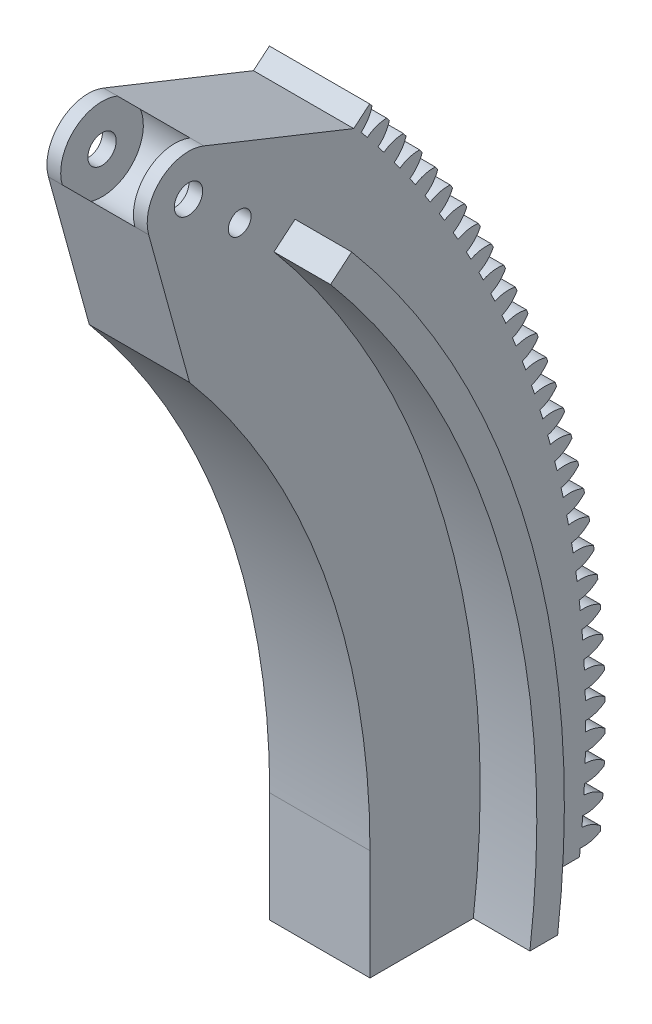
from build123d import *

# Parameters (mm, degrees)
TEETH_BLANK_DEPTH                              = 6.35
PRIMARY_BLANK_DEPTH                            = 29.464
TOOTH_CUT_DEPTH                                = 6.35
TOOTH_PATTERN_COUNT                            = 230
HOLES_FOR_TOP_SUPPORT_DEPTH                    = 284.05774535
HOLES_FOR_TOP_SUPPORT_DEPTH_BACK               = 284.05774535
SKETCH15_R                                     = 3.2639
THING_TO_SLIDE_ALONG_BEARINGS_DEPTH            = 9.87425
EXTENDING_START                                = 23.01875
EXTENDING_TEETH_DEPTH                          = 23.01875
SKETCH28_R                                     = 9.525
CUT_FOR_SPACE_FOR_TOP_SUPPORT_SCREWS_DEPTH     = 16.764
SKETCH29_R                                     = 3.429
MAGNET_HOLE_DEPTH                              = 12.7
CUT_START                                      = -3.175
CUT_TO_MAKE_SPACE_FOR_ALUMINUM_REINFORCE_DEPTH = 3.175
SKETCH31_R                                     = 2.6289
CUT_EXTRUDE1_DEPTH                             = 285.420834078


with BuildPart() as part:
    # Sketch11 → Teeth blank (new body)
    with BuildSketch(Plane(origin=(6.35, 0, 0), x_dir=(0, 0, -1), z_dir=(1, 0, 0))):
        with BuildLine():
            Line((177.722316491, 149.126730219), (155.660230842, 130.614442288))
            ThreePointArc((155.660230842, 130.614442288), (190.945540544, 69.498493124), (203.2, 0))
            ThreePointArc((203.2, 0), (202.801171077, -12.724975829), (201.606249903, -25.4))
            Line((201.606249903, -25.4), (230.605384683, -25.4))
            ThreePointArc((230.605384683, -25.4), (231.65108936, -12.719129025), (232.000007424, 0))
            ThreePointArc((232.000007424, 0), (218.008694999, 79.348675791), (177.722316491, 149.126730219))
        make_face()
    extrude(amount=-TEETH_BLANK_DEPTH)

    # Sketch1 → Primary blank (add)
    with BuildSketch(Plane(origin=(0, 0, 0), x_dir=(0, 0, -1), z_dir=(1, 0, 0))):
        with BuildLine():
            Line((177.8, 0), (177.8, -25.4))
            Line((177.8, -25.4), (225.775729431, -25.4))
            ThreePointArc((225.775729431, -25.4), (226.843652905, -12.71995034), (227.2, 0))
            ThreePointArc((227.2, 0), (213.498163443, 77.706976564), (174.045297477, 146.041344921))
            Line((174.045297477, 146.041344921), (139.503343029, 159.851365822))
            ThreePointArc((139.503343029, 159.851365822), (129.618020291, 158.107153482), (126.784391338, 148.47738561))
            Line((126.784391338, 148.47738561), (136.202701987, 114.287637002))
            ThreePointArc((136.202701987, 114.287637002), (167.077347976, 60.811181483), (177.8, 0))
        make_face()
    extrude(amount=PRIMARY_BLANK_DEPTH)

    # Sketch12 → Tooth cut (cut)
    with BuildSketch(Plane(origin=(6.35, 0, 0), x_dir=(0, 0, -1), z_dir=(1, 0, 0))):
        with BuildLine():
            ThreePointArc((227.497230324, 1.124058456), (230.494867292, 1.773780404), (232.972473, 3.581938572))
            ThreePointArc((232.972473, 3.581938572), (233.000007424, 0), (232.972473, -3.581938572))
            ThreePointArc((232.972473, -3.581938572), (230.494867292, -1.773780404), (227.497230324, -1.124058456))
            ThreePointArc((227.497230324, -1.124058456), (227.50000728, 0), (227.497230324, 1.124058456))
        make_face()
    tooth_cut = extrude(amount=-TOOTH_CUT_DEPTH, mode=Mode.SUBTRACT)

    # Tooth pattern: Tooth cut ×230 about axis
    tooth_pattern_axis = Axis((0, 0, 0), (1, 0, 0))
    for i in range(1, TOOTH_PATTERN_COUNT):
        add(tooth_cut.rotate(tooth_pattern_axis, i * 360 / TOOTH_PATTERN_COUNT), mode=Mode.SUBTRACT)

    # Sketch15 → Holes for top support (cut, two sides: drawn at the far end of the back side and taken through both)
    with BuildSketch(Plane(origin=(6.35, 0, 0), x_dir=(0, 0, -1), z_dir=(1, 0, 0)).offset(-HOLES_FOR_TOP_SUPPORT_DEPTH_BACK)):
        with Locations((135.967339212, 151.007028537)):
            Circle(SKETCH15_R)
    extrude(amount=HOLES_FOR_TOP_SUPPORT_DEPTH + HOLES_FOR_TOP_SUPPORT_DEPTH_BACK, mode=Mode.SUBTRACT)

    # Sketch23 → Thing to slide along bearings (add)
    with BuildSketch(Plane(origin=(0, 0, 0), x_dir=(0, 0, -1), z_dir=(1, 0, 0))):
        with BuildLine():
            Line((155.660230842, 130.614442288), (160.524613056, 134.69614361))
            ThreePointArc((160.524613056, 134.69614361), (196.912588686, 71.670321034), (209.55, 0))
            ThreePointArc((209.55, 0), (209.163370775, -12.723475387), (208.004909798, -25.4))
            Line((208.004909798, -25.4), (201.606249903, -25.4))
            ThreePointArc((201.606249903, -25.4), (202.801171077, -12.724975829), (203.2, 0))
            ThreePointArc((203.2, 0), (190.945540544, 69.498493124), (155.660230842, 130.614442288))
        make_face()
    thing_to_slide_along_bearings = extrude(amount=-THING_TO_SLIDE_ALONG_BEARINGS_DEPTH)

    # Mirroring slider: Thing to slide along bearings across plane
    add(thing_to_slide_along_bearings.mirror(Plane(origin=(14.732, 0, 0), x_dir=(0, 0, 1), z_dir=(1, 0, 0))))

    # Sketch27 → Extending teeth (add)
    with BuildSketch(Plane(origin=(6.35, 0, 0), x_dir=(0, 0, -1), z_dir=(1, 0, 0)).offset(EXTENDING_START)):
        with BuildLine():
            Line((177.722316491, 149.126730219), (174.045297477, 146.041344921))
            ThreePointArc((174.045297477, 146.041344921), (217.513785946, 65.632255207), (225.775729431, -25.4))
            Line((225.775729431, -25.4), (226.07762674, -25.4))
            ThreePointArc((226.07762674, -25.4), (226.171897735, -24.546404775), (226.262945845, -23.692459772))
            ThreePointArc((226.262945845, -23.692459772), (228.663101283, -23.551544215), (230.891757831, -22.649494707))
            ThreePointArc((230.891757831, -22.649494707), (230.94034564, -22.148593645), (230.987846786, -21.647588364))
            ThreePointArc((230.987846786, -21.647588364), (228.971262049, -20.338394215), (226.641640358, -19.743864063))
            ThreePointArc((226.641640358, -19.743864063), (226.736426656, -18.623805724), (226.825677683, -17.503292725))
            ThreePointArc((226.825677683, -17.503292725), (229.221088498, -17.296869983), (231.424274191, -16.33428174))
            ThreePointArc((231.424274191, -16.33428174), (231.459161859, -15.832240407), (231.492960423, -15.330124577))
            ThreePointArc((231.492960423, -15.330124577), (229.441367736, -14.07650152), (227.096375799, -13.545826347))
            ThreePointArc((227.096375799, -13.545826347), (227.160532561, -12.423596854), (227.219143699, -11.301064066))
            ThreePointArc((227.219143699, -11.301064066), (229.608022346, -11.029288179), (231.784093084, -10.006879521))
            ThreePointArc((231.784093084, -10.006879521), (231.805254577, -9.504072559), (231.825325337, -9.001220877))
            ThreePointArc((231.825325337, -9.001220877), (229.740255675, -7.804104412), (227.381643413, -7.337680228))
            ThreePointArc((227.381643413, -7.337680228), (227.415122764, -6.21411703), (227.443050275, -5.090402129))
            ThreePointArc((227.443050275, -5.090402129), (229.823614083, -4.753475906), (231.970946001, -3.672009792))
            ThreePointArc((231.970946001, -3.672009792), (231.978365527, -3.168812415), (231.984693505, -2.665600128))
            ThreePointArc((231.984693505, -2.665600128), (229.867702826, -1.525883589), (227.497230324, -1.124058456))
            ThreePointArc((227.497230324, -1.124058456), (227.50000728, 0), (227.497230324, 1.124058456))
            ThreePointArc((227.497230324, 1.124058456), (229.867702826, 1.525883589), (231.984693505, 2.665600128))
            ThreePointArc((231.984693505, 2.665600128), (231.978365527, 3.168812415), (231.970946001, 3.672009792))
            ThreePointArc((231.970946001, 3.672009792), (229.823614083, 4.753475906), (227.443050275, 5.090402129))
            ThreePointArc((227.443050275, 5.090402129), (227.415122764, 6.21411703), (227.381643413, 7.337680228))
            ThreePointArc((227.381643413, 7.337680228), (229.740255675, 7.804104412), (231.825325337, 9.001220877))
            ThreePointArc((231.825325337, 9.001220877), (231.805254577, 9.504072559), (231.784093084, 10.006879521))
            ThreePointArc((231.784093084, 10.006879521), (229.608022346, 11.029288179), (227.219143699, 11.301064066))
            ThreePointArc((227.219143699, 11.301064066), (227.160532561, 12.423596854), (227.096375799, 13.545826347))
            ThreePointArc((227.096375799, 13.545826347), (229.441367736, 14.07650152), (231.492960423, 15.330124577))
            ThreePointArc((231.492960423, 15.330124577), (231.459161859, 15.832240407), (231.424274191, 16.33428174))
            ThreePointArc((231.424274191, 16.33428174), (229.221088498, 17.296869983), (226.825677683, 17.503292725))
            ThreePointArc((226.825677683, 17.503292725), (226.736426656, 18.623805724), (226.641640358, 19.743864063))
            ThreePointArc((226.641640358, 19.743864063), (228.971262049, 20.338394215), (230.987846786, 21.647588364))
            ThreePointArc((230.987846786, 21.647588364), (230.94034564, 22.148593645), (230.891757831, 22.649494707))
            ThreePointArc((230.891757831, 22.649494707), (228.663101283, 23.551544215), (226.262945845, 23.692459772))
            ThreePointArc((226.262945845, 23.692459772), (226.143121532, 24.810116812), (226.017776432, 25.927168167))
            ThreePointArc((226.017776432, 25.927168167), (228.330289425, 26.585109638), (230.310361361, 27.94889791))
            ThreePointArc((230.310361361, 27.94889791), (230.24919308, 28.448418771), (230.186941388, 28.947805772))
            ThreePointArc((230.186941388, 28.947805772), (227.934477093, 29.788643403), (225.531368117, 29.863946617))
            ThreePointArc((225.531368117, 29.863946617), (225.381059935, 30.977913661), (225.225249571, 32.091124447))
            ThreePointArc((225.225249571, 32.091124447), (227.518928183, 32.811986256), (229.461009714, 34.22935094))
            ThreePointArc((229.461009714, 34.22935094), (229.386219944, 34.727014622), (229.310350824, 35.2245149))
            ThreePointArc((229.310350824, 35.2245149), (227.035759654, 36.003513188), (224.631490431, 36.013147865))
            ThreePointArc((224.631490431, 36.013147865), (224.450810546, 37.12259363), (224.264651187, 38.231133128))
            ThreePointArc((224.264651187, 38.231133128), (226.537783789, 39.01437734), (228.440425662, 40.484260746))
            ThreePointArc((228.440425662, 40.484260746), (228.352070214, 40.979695873), (228.262640281, 41.474938174))
            ThreePointArc((228.262640281, 41.474938174), (225.967619622, 42.191515802), (223.563984308, 42.135474753))
            ThreePointArc((223.563984308, 42.135474753), (223.353067549, 43.239571328), (223.136698117, 44.342612304))
            ThreePointArc((223.136698117, 44.342612304), (225.387588412, 45.187654434), (227.249370803, 46.70895968))
            ThreePointArc((227.249370803, 46.70895968), (227.147515611, 47.201796539), (227.044591603, 47.694411295))
            ThreePointArc((227.044591603, 47.694411295), (224.730854085, 48.348033526), (222.329646362, 48.226358571))
            ThreePointArc((222.329646362, 48.226358571), (222.088650124, 49.324282038), (221.84223208, 50.421001361))
            ThreePointArc((221.84223208, 50.421001361), (224.06920037, 51.327210806), (225.888733947, 52.898802637))
            ThreePointArc((225.888733947, 52.898802637), (225.773455019, 53.388673455), (225.657113741, 53.878293059))
            ThreePointArc((225.657113741, 53.878293059), (223.326385962, 54.468472135), (220.929397701, 54.281254073))
            ThreePointArc((220.929397701, 54.281254073), (220.658501825, 55.37218512), (220.382219056, 56.461764377))
            ThreePointArc((220.382219056, 56.461764377), (222.583603493, 57.428464891), (224.359530453, 59.049170525))
            ThreePointArc((224.359530453, 59.049170525), (224.230913815, 59.535709743), (224.101242084, 60.021968822))
            ThreePointArc((224.101242084, 60.021968822), (221.75526332, 60.54826433), (219.364283245, 60.295642869))
            ThreePointArc((219.364283245, 60.295642869), (219.063689882, 61.378767402), (218.75774856, 62.460393508))
            ThreePointArc((218.75774856, 62.460393508), (220.931906389, 63.486863702), (222.662901469, 65.15547371))
            ThreePointArc((222.662901469, 65.15547371), (222.521043099, 65.638318252), (222.378137682, 66.120853942))
            ThreePointArc((222.378137682, 66.120853942), (220.01865859, 66.58287314), (217.635470939, 66.265036796))
            ThreePointArc((217.635470939, 66.265036796), (217.305404404, 67.339546548), (216.970032835, 68.412412353))
            ThreePointArc((216.970032835, 68.412412353), (219.115341617, 69.497886237), (220.800113083, 71.213155438))
            ThreePointArc((220.800113083, 71.213155438), (220.645118841, 71.691944989), (220.489086379, 72.170397203))
            ThreePointArc((220.489086379, 72.170397203), (218.117867692, 72.567795315), (215.744250889, 72.18498127))
            ThreePointArc((215.744250889, 72.18498127), (215.384957489, 73.250074401), (215.02040594, 74.313379293))
            ThreePointArc((215.02040594, 74.313379293), (217.135264766, 75.457046844), (218.772555378, 77.21769524))
            ThreePointArc((218.772555378, 77.21769524), (218.604540927, 77.69207251), (218.435497858, 78.166084208))
            ThreePointArc((218.435497858, 78.166084208), (216.054309067, 78.498564682), (213.692034393, 78.051058605))
            ThreePointArc((213.692034393, 78.051058605), (213.303782248, 79.105940303), (212.91032276, 80.158890803))
            ThreePointArc((212.91032276, 80.158890803), (214.993153443, 81.359898575), (216.581741393, 83.164612305))
            ThreePointArc((216.581741393, 83.164612305), (216.400832112, 83.634223294), (216.218904581, 84.103440753))
            ThreePointArc((216.218904581, 84.103440753), (213.829522619, 84.370755478), (211.480352893, 83.858891315))
            ThreePointArc((211.480352893, 83.858891315), (211.06343173, 84.902774388), (210.641357917, 85.944584746))
            ThreePointArc((210.641357917, 85.944584746), (212.690606171, 87.202036501), (214.229305997, 89.049468819))
            ThreePointArc((214.229305997, 89.049468819), (214.035636886, 89.513963087), (213.840960655, 89.978036158))
            ThreePointArc((213.840960655, 89.978036158), (211.445168568, 90.179985654), (209.110856828, 89.604145378))
            ThreePointArc((209.110856828, 89.604145378), (208.66557777, 90.63625084), (208.2152046, 91.666143618))
            ThreePointArc((208.2152046, 91.666143618), (210.229341199, 92.979100999), (211.717004663, 94.867873282))
            ThreePointArc((211.717004663, 94.867873282), (211.510720247, 95.326904206), (211.30344059, 95.78548658))
            ThreePointArc((211.30344059, 95.78548658), (208.903026208, 95.921920145), (206.585314405, 95.28253347))
            ThreePointArc((206.585314405, 95.28253347), (206.112009735, 96.302091126), (205.633673294, 97.319297778))
            ThreePointArc((205.633673294, 97.319297778), (207.611195213, 98.686781007), (209.046712167, 100.615483783))
            ThreePointArc((209.046712167, 100.615483783), (208.827966381, 101.068708817), (208.608237979, 101.521458283))
            ThreePointArc((208.608237979, 101.521458283), (206.204992582, 101.592274105), (203.905610279, 100.889818164))
            ThreePointArc((203.905610279, 100.889818164), (203.404633195, 101.896067182), (202.898690434, 102.899828632))
            ThreePointArc((202.898690434, 102.899828632), (204.838121973, 104.320817242), (206.220421179, 106.28801124))
            ThreePointArc((206.220421179, 106.28801124), (205.989377261, 106.735092169), (205.757364083, 107.181670869))
            ThreePointArc((205.757364083, 107.181670869), (203.353081061, 107.186816103), (201.073744144, 106.421815095))
            ThreePointArc((201.073744144, 106.421815095), (200.545468495, 107.414004574), (200.012296968, 108.403571777))
            ThreePointArc((200.012296968, 108.403571777), (201.91219085, 109.877005372), (203.240240785, 111.881222599))
            ThreePointArc((203.240240785, 111.881222599), (202.997071148, 112.321825796), (202.752946331, 112.761900475))
            ThreePointArc((202.752946331, 112.761900475), (200.349419851, 112.701371281), (198.091829247, 111.874396079))
            ThreePointArc((198.091829247, 111.874396079), (197.53664925, 112.851785611), (196.97664683, 113.826420114))
            ThreePointArc((196.97664683, 113.826420114), (198.835585283, 115.351199164), (200.108394907, 117.390943997))
            ThreePointArc((200.108394907, 117.390943997), (199.853281013, 117.824740666), (199.597226732, 118.257982925))
            ThreePointArc((199.597226732, 118.257982925), (197.196250396, 118.131824473), (194.962090802, 117.243492197))
            ThreePointArc((194.962090802, 117.243492197), (194.380420754, 118.205352416), (193.794005336, 119.164326911))
            ThreePointArc((193.794005336, 119.164326911), (195.610601151, 120.739313568), (196.827220645, 122.813063873))
            ThreePointArc((196.827220645, 122.813063873), (196.56035287, 123.2397303), (196.292560202, 123.665816837))
            ThreePointArc((196.292560202, 123.665816837), (193.895925708, 123.47412327), (191.686864339, 122.525096826))
            ThreePointArc((191.686864339, 122.525096826), (191.079138305, 123.470709957), (190.466747493, 124.413308821))
            ThreePointArc((190.466747493, 124.413308821), (192.239645057, 126.037327771), (193.399166535, 128.143536038))
            ThreePointArc((193.399166535, 128.143536038), (193.120744025, 128.562753829), (192.841412808, 128.981366682))
            ThreePointArc((192.841412808, 128.981366682), (190.450908614, 128.724281049), (188.268593954, 127.715268637))
            ThreePointArc((188.268593954, 127.715268637), (187.635265441, 128.643929027), (186.997356225, 129.569448858))
            ThreePointArc((186.997356225, 129.569448858), (188.725232536, 131.241288196), (189.826790719, 133.378382695))
            ThreePointArc((189.826790719, 133.378382695), (189.537021244, 133.789839012), (189.246359924, 134.200665797))
            ThreePointArc((189.246359924, 134.200665797), (186.863769915, 133.878379945), (184.709830489, 132.810134528))
            ThreePointArc((184.709830489, 132.810134528), (184.05137211, 133.721149176), (183.388420522, 134.628899316))
            ThreePointArc((183.388420522, 134.628899316), (185.069986174, 136.347311455), (186.112759037, 138.513697403))
            ThreePointArc((186.112759037, 138.513697403), (185.811858834, 138.917085204), (185.510084314, 139.319819345))
            ThreePointArc((185.510084314, 139.319819345), (183.137186467, 138.932573777), (181.013229625, 137.805892519))
            ThreePointArc((181.013229625, 137.805892519), (180.330132748, 138.698581592), (179.642633506, 139.587884644))
            ThreePointArc((179.642633506, 139.587884644), (181.276633653, 141.351587239), (182.25984304, 143.545648))
            ThreePointArc((182.25984304, 143.545648), (181.948036652, 143.94066626), (181.635374127, 144.335007224))
            ThreePointArc((181.635374127, 144.335007224), (179.273939188, 143.883090915), (177.181549907, 142.698814589))
            ThreePointArc((177.181549907, 142.698814589), (176.474324282, 143.572511928), (175.762790426, 144.442704261))
            ThreePointArc((175.762790426, 144.442704261), (177.348005713, 146.250381172), (178.270917918, 148.470479455))
            ThreePointArc((178.270917918, 148.470479455), (177.996919643, 148.798857665), (177.722316491, 149.126730219))
        make_face()
    extrude(amount=-EXTENDING_TEETH_DEPTH)

    # Sketch28 → Cut for space for top support screws (cut)
    with BuildSketch(Plane(origin=(6.35, 0, 0), x_dir=(0, 0, -1), z_dir=(1, 0, 0))):
        with Locations((135.967339212, 151.007028537)):
            Circle(SKETCH28_R)
    extrude(amount=CUT_FOR_SPACE_FOR_TOP_SUPPORT_SCREWS_DEPTH, mode=Mode.SUBTRACT)

    # Sketch29 → Magnet hole (cut)
    with BuildSketch(Plane.XZ.offset(25.4)):
        with Locations((14.7081875, -201.93881337)):
            Circle(SKETCH29_R)
    extrude(amount=-MAGNET_HOLE_DEPTH, mode=Mode.SUBTRACT)

    # Sketch30 → Cut to make space for aluminum reinforcement plate (cut)
    with BuildSketch(Plane(origin=(29.464, 0, 0), x_dir=(0, 0, -1), z_dir=(1, 0, 0)).offset(CUT_START)):
        with BuildLine():
            Line((174.045297477, 146.041344921), (183.774061904, 154.204747564))
            ThreePointArc((183.774061904, 154.204747564), (229.465031087, 69.98435188), (238.551566752, -25.4))
            Line((238.551566752, -25.4), (225.775729431, -25.4))
            Line((225.775729431, -25.4), (208.004909798, -25.4))
            ThreePointArc((208.004909798, -25.4), (200.900960932, 59.581930119), (160.524613056, 134.69614361))
            Line((160.524613056, 134.69614361), (155.660230842, 130.614442288))
            ThreePointArc((155.660230842, 130.614442288), (194.922962004, 57.404519712), (201.606249903, -25.4))
            Line((201.606249903, -25.4), (177.8, -25.4))
            Line((177.8, -25.4), (177.8, 0))
            ThreePointArc((177.8, 0), (167.077347976, 60.811181483), (136.202701987, 114.287637002))
            Line((136.202701987, 114.287637002), (126.784391338, 148.47738561))
            ThreePointArc((126.784391338, 148.47738561), (129.618020291, 158.107153482), (139.503343029, 159.851365822))
            Line((139.503343029, 159.851365822), (174.045297477, 146.041344921))
        make_face()
    cut_to_make_space_for_aluminum_reinforce = extrude(amount=CUT_TO_MAKE_SPACE_FOR_ALUMINUM_REINFORCE_DEPTH, mode=Mode.SUBTRACT)

    # Mirroring the above cut: Cut to make space for aluminum reinforcement plate across plane
    add(cut_to_make_space_for_aluminum_reinforce.mirror(Plane(origin=(14.732, 0, 0), x_dir=(0, 0, 1), z_dir=(1, 0, 0))), mode=Mode.SUBTRACT)

    # Sketch31 → Cut-Extrude1 (cut, through all)
    with BuildSketch(Plane.ZY.offset(-3.175)):
        with Locations((-147.764763317, 140.384580161)):
            Circle(SKETCH31_R)
    extrude(amount=-CUT_EXTRUDE1_DEPTH, mode=Mode.SUBTRACT)


solid = part.part
